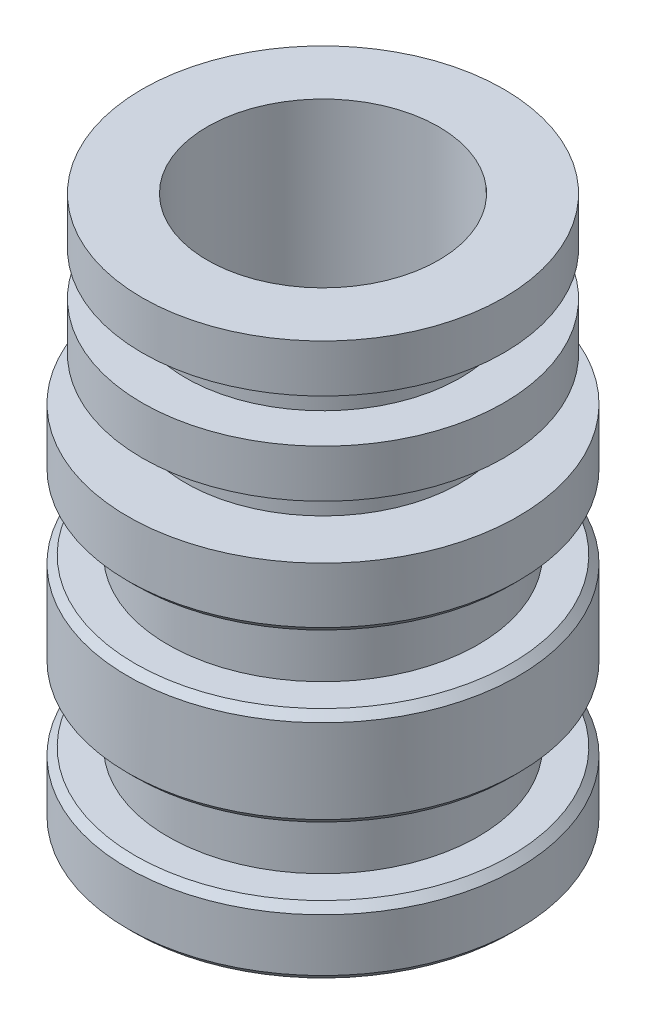
from build123d import *

# Parameters (mm, degrees)
ESQUISSE4_R             = 3
ENL_V_MAT_EXTRU_3_DEPTH = 43.347845282
CHANFREIN4_SIZE         = 1
CHANFREIN3_SIZE         = 0.5


with BuildPart() as part:
    # Esquisse1 → Révolution1 (revolve)
    with BuildSketch(Plane.XY):
        Polygon((0, 0), (-13.5, 0), (-13.5, 4.64), (-10.73, 4.64), (-10.73, 9.34), (-13.5, 9.34), (-13.5, 16.14), (-10.73, 16.14), (-10.73, 20.84), (-13.5, 20.84), (-13.5, 25.2), (-12.5, 25.2), (-9.5, 25.2), (-9.5, 28.2), (-12.5, 28.2), (-12.5, 31.5), (-9.5, 31.5), (-9.5, 34.5), (-12.5, 34.5), (-12.5, 37.8), (-8, 37.8), (-8, 20.84), (-8, 8), (0, 8), align=None)
    revolve(axis=Axis((0, -29.115408637, 0), (0, 1, 0)))

    # Esquisse4 → Enlèv. mat.-Extru.3 (cut, through all)
    with BuildSketch(Plane.XZ):
        Circle(ESQUISSE4_R)
    extrude(amount=-ENL_V_MAT_EXTRU_3_DEPTH, mode=Mode.SUBTRACT)

    # Chanfrein4
    chanfrein4_edges = [part.edges().sort_by_distance(p)[0] for p in [
        (-3, 8, 0),
        (-3, 0, 0),
    ]]
    chamfer(chanfrein4_edges, length=CHANFREIN4_SIZE)

    # Chanfrein3
    chanfrein3_edges = [part.edges().sort_by_distance(p)[0] for p in [
        (13.5, 0, 0),
        (13.5, 20.84, 0),
        (13.5, 16.14, 0),
        (13.5, 9.34, 0),
        (13.5, 4.64, 0),
    ]]
    chamfer(chanfrein3_edges, length=CHANFREIN3_SIZE)


solid = part.part
